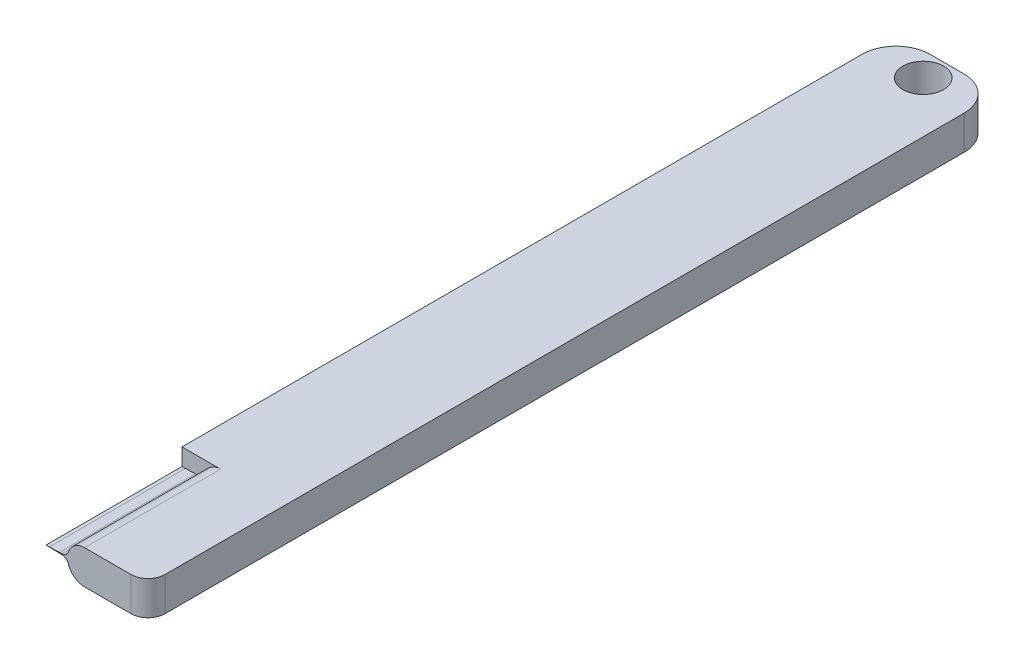
from build123d import *

# Parameters (mm, degrees)
SKETCH2_W           = 30
SKETCH2_H           = 10
BOSS_EXTRUDE1_DEPTH = 250
SKETCH3_R           = 6
CUT_EXTRUDE1_DEPTH  = 30
FILLET1_R           = 10
FILLET3_R           = 10
CUT_EXTRUDE2_DEPTH  = 40
FILLET4_R           = 5
FILLET5_R           = 5
FILLET6_R           = 5


with BuildPart() as part:
    # Sketch2 → Boss-Extrude1 (new body)
    with BuildSketch(Plane.XY):
        with Locations((15, 5)):
            Rectangle(SKETCH2_W, SKETCH2_H)
    extrude(amount=BOSS_EXTRUDE1_DEPTH)

    # Sketch3 → Cut-Extrude1 (cut)
    with BuildSketch(Plane(origin=(0, 10, 0), x_dir=(1, 0, 0), z_dir=(0, 1, 0))):
        with Locations((15, -7)):
            Circle(SKETCH3_R)
    extrude(amount=-CUT_EXTRUDE1_DEPTH, mode=Mode.SUBTRACT)

    # Fillet1
    fillet1_edges = [part.edges().sort_by_distance(p)[0] for p in [
        (30, 5, 0),
    ]]
    fillet(fillet1_edges, radius=FILLET1_R)

    # Fillet3
    fillet3_edges = [part.edges().sort_by_distance(p)[0] for p in [
        (0, 5, 0),
    ]]
    fillet(fillet3_edges, radius=FILLET3_R)

    # Sketch5 → Cut-Extrude2 (cut)
    with BuildSketch(Plane.XY.offset(250)):
        with BuildLine():
            Line((0, 10), (0, 5))
            Line((0, 5), (1, 5.017455065))
            Line((1, 5.017455065), (4, 5.122217373))
            Line((4, 5.122217373), (4.687433408, 5.134216568))
            ThreePointArc((4.687433408, 5.134216568), (5.779010382, 5.481326474), (6.501094127, 6.370494985))
            Line((6.501094127, 6.370494985), (8, 10))
            Line((8, 10), (0, 10))
        make_face()
        with BuildLine():
            Line((1, 4.982544935), (0, 5))
            Line((0, 5), (0, 0))
            Line((0, 0), (8, 0))
            Line((8, 0), (6.501094127, 3.629505015))
            ThreePointArc((6.501094127, 3.629505015), (5.779010382, 4.518673526), (4.687433408, 4.865783432))
            Line((4.687433408, 4.865783432), (4, 4.877782627))
            Line((4, 4.877782627), (1, 4.982544935))
        make_face()
    extrude(amount=-CUT_EXTRUDE2_DEPTH, mode=Mode.SUBTRACT)

    # Fillet4
    fillet4_edges = [part.edges().sort_by_distance(p)[0] for p in [
        (8, 10, 230),
    ]]
    fillet(fillet4_edges, radius=FILLET4_R)

    # Fillet5
    fillet5_edges = [part.edges().sort_by_distance(p)[0] for p in [
        (8, 0, 230),
    ]]
    fillet(fillet5_edges, radius=FILLET5_R)

    # Fillet6
    fillet6_edges = [part.edges().sort_by_distance(p)[0] for p in [
        (30, 5, 250),
    ]]
    fillet(fillet6_edges, radius=FILLET6_R)


solid = part.part
